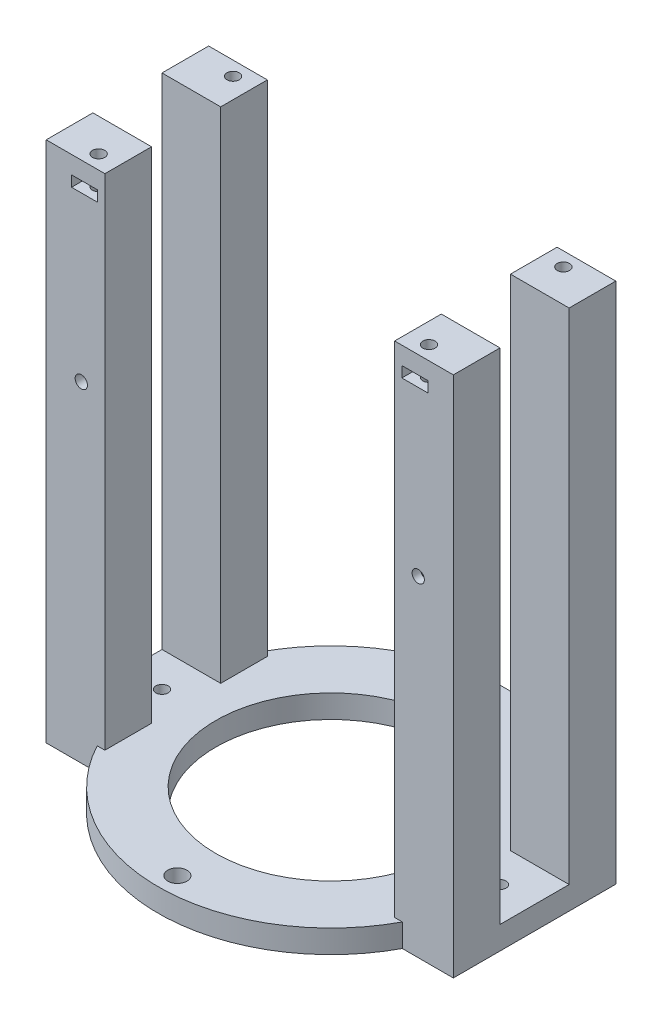
from build123d import *

# Parameters (mm, degrees)
BODY_DEPTH                    = 6
SKETCH2_W                     = 10.280011329
SKETCH2_H                     = 42.3
SKETCH2_W_2                   = 2
WINGS_DEPTH                   = 130
SKETCH3_R                     = 1.6
MOUNTING_BORE_DEPTH           = 152.726728034
CUT_EXCESS_MATERIAL_DEPTH     = 175.702604445
CUT_BATTERY_MOUNT_REACH       = 153.727
SKETCH6_R                     = 1.6
SKETCH8_W                     = 6.8
SKETCH8_H                     = 2.8
CAPTURE_NUT_1_DEPTH           = 7.3
CIRPATTERN1_COUNT             = 2
SKETCH10_W                    = 6.8
SKETCH10_H                    = 2.8
CAPTURE_NUT_2_DEPTH           = 7.3
CIRPATTERN2_COUNT             = 2
CUT_CENTER_HOLE_REACH         = 153.727
SKETCH11_R                    = 30
CUT_HARNESS_MOUNT_REACH       = 153.727
SKETCH12_R                    = 2.5
CAPTIVE_NUT_WALL_1_DEPTH      = 2.8
CAPTIVE_NUT_WALL_2_REACH      = 147.131
CAPTIVE_NUT_WALL_3_REACH      = 147.131
CAPTIVE_NUT_WALL_4_REACH      = 147.131
MIDDLE_DECK_HOLES_REACH       = 161.285
SKETCH20_R                    = 1.6
MIDDLE_DECK_CAPTIVE_NUT_DEPTH = 2.5
WING_EXTRA_WIDTH_1_DEPTH      = 3
WING_EXTRA_WIDTH_2_DEPTH      = 3


with BuildPart() as part:
    # Sketch1 → body (new body)
    with BuildSketch(Plane(origin=(0, 0, 0), x_dir=(1, 0, 0), z_dir=(0, 1, 0))):
        with BuildLine():
            ThreePointArc((-39.719988671, -21.15), (-45, 0), (-39.719988671, 21.15))
            Line((-39.719988671, 21.15), (-50, 21.15))
            Line((-50, 21.15), (-50, -21.15))
            Line((-50, -21.15), (-39.719988671, -21.15))
        make_face()
        with BuildLine():
            Line((-16, -21.15), (-16, 21.15))
            Line((-16, 21.15), (-39.719988671, 21.15))
            ThreePointArc((-39.719988671, 21.15), (-45, 0), (-39.719988671, -21.15))
            Line((-39.719988671, -21.15), (-16, -21.15))
        make_face()
        with BuildLine():
            Line((-39.719988671, 21.15), (-16, 21.15))
            Line((-16, 21.15), (-16, -21.15))
            Line((-16, -21.15), (-39.719988671, -21.15))
            ThreePointArc((-39.719988671, -21.15), (0, -45), (39.719988671, -21.15))
            Line((39.719988671, -21.15), (16, -21.15))
            Line((16, -21.15), (16, 21.15))
            Line((16, 21.15), (39.719988671, 21.15))
            ThreePointArc((39.719988671, 21.15), (0, 45), (-39.719988671, 21.15))
        make_face()
        with BuildLine():
            ThreePointArc((45, 0), (43.66004747, 10.899552968), (39.719988671, 21.15))
            Line((39.719988671, 21.15), (16, 21.15))
            Line((16, 21.15), (16, -21.15))
            Line((16, -21.15), (39.719988671, -21.15))
            ThreePointArc((39.719988671, -21.15), (43.66004747, -10.899552968), (45, 0))
        make_face()
        with BuildLine():
            Line((50, 21.15), (39.719988671, 21.15))
            ThreePointArc((39.719988671, 21.15), (43.66004747, 10.899552968), (45, 0))
            ThreePointArc((45, 0), (43.66004747, -10.899552968), (39.719988671, -21.15))
            Line((39.719988671, -21.15), (50, -21.15))
            Line((50, -21.15), (50, 21.15))
        make_face()
    extrude(amount=BODY_DEPTH)

    # Sketch2 → wings (add)
    with BuildSketch(Plane(origin=(0, 6, 0), x_dir=(1, 0, 0), z_dir=(0, 1, 0))):
        with Locations((44.859994336, 0)):
            Rectangle(SKETCH2_W, SKETCH2_H)
        with Locations((-44.859994336, 0)):
            Rectangle(SKETCH2_W, SKETCH2_H)
        with Locations((-38.719988671, 0)):
            Rectangle(SKETCH2_W_2, SKETCH2_H)
        with Locations((38.719988671, 0)):
            Rectangle(SKETCH2_W_2, SKETCH2_H)
    extrude(amount=WINGS_DEPTH)

    # Sketch3 → mounting-bore (cut, through all)
    with BuildSketch(Plane(origin=(0, 136, 0), x_dir=(1, 0, 0), z_dir=(0, 1, 0))):
        with Locations(Location((43, -17.5, 0), (0, 0, 270))):
            Circle(SKETCH3_R)
        with Locations(Location((-43, -17.5, 0), (0, 0, 270))):
            Circle(SKETCH3_R)
        with Locations(Location((-43, 17.5, 0), (0, 0, 270))):
            Circle(SKETCH3_R)
        with Locations(Location((43, 17.5, 0), (0, 0, 270))):
            Circle(SKETCH3_R)
    extrude(amount=-MOUNTING_BORE_DEPTH, mode=Mode.SUBTRACT)

    # Sketch5 → cut-excess-material (cut, through all)
    with BuildSketch(Plane(origin=(50, 0, 0), x_dir=(0, 0, -1), z_dir=(1, 0, 0))):
        Polygon((0, 6), (9, 6), (9, 136), (-9, 136), (-9, 6), align=None)
    extrude(amount=-CUT_EXCESS_MATERIAL_DEPTH, mode=Mode.SUBTRACT)

    # Sketch6 → cut-battery-mount (cut, up to next)
    with BuildSketch(Plane.XZ, mode=Mode.PRIVATE) as cut_battery_mount_sk1:
        with Locations(Location((-44, 0, 0), (0, 0, 270))):
            Circle(SKETCH6_R)
    cut_battery_mount_tool1 = extrude(cut_battery_mount_sk1.sketch, amount=-CUT_BATTERY_MOUNT_REACH, mode=Mode.PRIVATE) & part.part
    # Sketch6 → cut-battery-mount (cut, up to next)
    with BuildSketch(Plane.XZ, mode=Mode.PRIVATE) as cut_battery_mount_sk2:
        with Locations(Location((44, 0, 0), (0, 0, 270))):
            Circle(SKETCH6_R)
    cut_battery_mount_tool2 = extrude(cut_battery_mount_sk2.sketch, amount=-CUT_BATTERY_MOUNT_REACH, mode=Mode.PRIVATE) & part.part
    add(cut_battery_mount_tool1.solids().sort_by_distance((-44, 0, 0))[0], mode=Mode.SUBTRACT)
    add(cut_battery_mount_tool2.solids().sort_by_distance((44, 0, 0))[0], mode=Mode.SUBTRACT)

    # Sketch8 → capture-nut-1 (cut)
    with BuildSketch(Plane.XY.offset(21.15)):
        with Locations((42.999988671, 130)):
            Rectangle(SKETCH8_W, SKETCH8_H)
    capture_nut_1 = extrude(amount=-CAPTURE_NUT_1_DEPTH, mode=Mode.SUBTRACT)

    # CirPattern1: capture-nut-1 ×2 about axis
    cirpattern1_axis = Axis((0, 0, 0), (0, 1, 0))
    for i in range(1, CIRPATTERN1_COUNT):
        add(capture_nut_1.rotate(cirpattern1_axis, i * 360 / CIRPATTERN1_COUNT), mode=Mode.SUBTRACT)

    # Sketch10 → capture-nut-2 (cut)
    with BuildSketch(Plane(origin=(0, 0, -21.15), x_dir=(-1, 0, 0), z_dir=(0, 0, -1))):
        with Locations((-42.999988671, 130)):
            Rectangle(SKETCH10_W, SKETCH10_H)
    capture_nut_2 = extrude(amount=-CAPTURE_NUT_2_DEPTH, mode=Mode.SUBTRACT)

    # CirPattern2: capture-nut-2 ×2 about axis
    cirpattern2_axis = Axis((0, 0, 0), (0, 1, 0))
    for i in range(1, CIRPATTERN2_COUNT):
        add(capture_nut_2.rotate(cirpattern2_axis, i * 360 / CIRPATTERN2_COUNT), mode=Mode.SUBTRACT)

    # Sketch11 → cut-center-hole (cut, up to next)
    with BuildSketch(Plane.XZ, mode=Mode.PRIVATE) as cut_center_hole_sk1:
        with Locations(Location((0, 0, 0), (0, 0, 270))):
            Circle(SKETCH11_R)
    cut_center_hole_tool1 = extrude(cut_center_hole_sk1.sketch, amount=-CUT_CENTER_HOLE_REACH, mode=Mode.PRIVATE) & part.part
    add(cut_center_hole_tool1.solids().sort_by_distance((0, 0, 0))[0], mode=Mode.SUBTRACT)

    # Sketch12 → cut-harness-mount (cut, up to next)
    with BuildSketch(Plane.XZ, mode=Mode.PRIVATE) as cut_harness_mount_sk1:
        with Locations(Location((0, -40, 0), (0, 0, 270))):
            Circle(SKETCH12_R)
    cut_harness_mount_tool1 = extrude(cut_harness_mount_sk1.sketch, amount=-CUT_HARNESS_MOUNT_REACH, mode=Mode.PRIVATE) & part.part
    # Sketch12 → cut-harness-mount (cut, up to next)
    with BuildSketch(Plane.XZ, mode=Mode.PRIVATE) as cut_harness_mount_sk2:
        with Locations(Location((0, 40, 0), (0, 0, 270))):
            Circle(SKETCH12_R)
    cut_harness_mount_tool2 = extrude(cut_harness_mount_sk2.sketch, amount=-CUT_HARNESS_MOUNT_REACH, mode=Mode.PRIVATE) & part.part
    add(cut_harness_mount_tool1.solids().sort_by_distance((0, 0, -40))[0], mode=Mode.SUBTRACT)
    add(cut_harness_mount_tool2.solids().sort_by_distance((0, 0, 40))[0], mode=Mode.SUBTRACT)

    # Sketch13 → captive-nut-wall-1 (add)
    with BuildSketch(Plane(origin=(0, 128.6, 0), x_dir=(1, 0, 0), z_dir=(0, 1, 0))):
        Polygon((46.399988671, 13.85), (46.399988671, 17.5), (44.699994335, 14.555523439), (41.300005665, 14.555523439), (39.600011329, 17.5), (39.599988671, 13.85), align=None)
    extrude(amount=CAPTIVE_NUT_WALL_1_DEPTH)

    # Sketch14 → captive-nut-wall-2 (add, up to next)
    with BuildSketch(Plane(origin=(0, 128.6, 0), x_dir=(1, 0, 0), z_dir=(0, 1, 0)), mode=Mode.PRIVATE) as captive_nut_wall_2_sk1:
        Polygon((-39.599988671, 13.85), (-39.599988671, 17.5), (-41.299994335, 14.555503816), (-44.700005665, 14.555503816), (-46.400011329, 17.5), (-46.400011329, 13.85), align=None)
    captive_nut_wall_2_tool1 = extrude(captive_nut_wall_2_sk1.sketch, amount=CAPTIVE_NUT_WALL_2_REACH, mode=Mode.PRIVATE) - part.part
    add(captive_nut_wall_2_tool1.solids().sort_by_distance((-39.677166, 128.6, -15.675))[0])

    # Sketch16 → captive-nut-wall-3 (add, up to next)
    with BuildSketch(Plane(origin=(0, 128.6, 0), x_dir=(1, 0, 0), z_dir=(0, 1, 0)), mode=Mode.PRIVATE) as captive_nut_wall_3_sk1:
        Polygon((-46.399988671, -13.85), (-46.399988671, -17.5), (-44.699994335, -14.555523439), (-41.300005665, -14.555523439), (-39.600011329, -17.5), (-39.600011329, -13.85), align=None)
    captive_nut_wall_3_tool1 = extrude(captive_nut_wall_3_sk1.sketch, amount=CAPTIVE_NUT_WALL_3_REACH, mode=Mode.PRIVATE) - part.part
    add(captive_nut_wall_3_tool1.solids().sort_by_distance((-46.322812, 128.6, 15.675))[0])

    # Sketch17 → captive-nut-wall-4 (add, up to next)
    with BuildSketch(Plane(origin=(0, 128.6, 0), x_dir=(1, 0, 0), z_dir=(0, 1, 0)), mode=Mode.PRIVATE) as captive_nut_wall_4_sk1:
        Polygon((39.599988671, -13.85), (39.599988671, -17.5), (41.299994335, -14.555503816), (44.700005665, -14.555503816), (46.400011329, -17.5), (46.400011329, -13.85), align=None)
    captive_nut_wall_4_tool1 = extrude(captive_nut_wall_4_sk1.sketch, amount=CAPTIVE_NUT_WALL_4_REACH, mode=Mode.PRIVATE) - part.part
    add(captive_nut_wall_4_tool1.solids().sort_by_distance((39.677166, 128.6, 15.675))[0])

    # Sketch20 → middle-deck-holes (cut, up to next)
    with BuildSketch(Plane.XY.offset(21.15), mode=Mode.PRIVATE) as middle_deck_holes_sk1:
        with Locations((-43.859994335, 86)):
            Circle(SKETCH20_R)
    middle_deck_holes_tool1 = extrude(middle_deck_holes_sk1.sketch, amount=-MIDDLE_DECK_HOLES_REACH, mode=Mode.PRIVATE) & part.part
    # Sketch20 → middle-deck-holes (cut, up to next)
    with BuildSketch(Plane.XY.offset(21.15), mode=Mode.PRIVATE) as middle_deck_holes_sk2:
        with Locations((43.859994335, 86)):
            Circle(SKETCH20_R)
    middle_deck_holes_tool2 = extrude(middle_deck_holes_sk2.sketch, amount=-MIDDLE_DECK_HOLES_REACH, mode=Mode.PRIVATE) & part.part
    add(middle_deck_holes_tool1.solids().sort_by_distance((-43.859994, 86, 21.15))[0], mode=Mode.SUBTRACT)
    add(middle_deck_holes_tool2.solids().sort_by_distance((43.859994, 86, 21.15))[0], mode=Mode.SUBTRACT)

    # Sketch21 → middle-deck-captive-nut (cut)
    with BuildSketch(Plane(origin=(0, 0, 9), x_dir=(-1, 0, 0), z_dir=(0, 0, -1))):
        Polygon((44.609427523, 89.111004644), (41.540501876, 88.204530501), (40.791068688, 85.093525857), (43.110561148, 82.888995356), (46.179486795, 83.795469499), (46.928919982, 86.906474143), align=None)
        Polygon((-43.110561148, 89.111004644), (-46.179486795, 88.204530501), (-46.928919982, 85.093525857), (-44.609427523, 82.888995356), (-41.540501876, 83.795469499), (-40.791068688, 86.906474143), align=None)
    extrude(amount=-MIDDLE_DECK_CAPTIVE_NUT_DEPTH, mode=Mode.SUBTRACT)

    # Sketch22 → wing-extra-width-1 (add)
    with BuildSketch(Plane(origin=(50, 0, 0), x_dir=(0, 0, -1), z_dir=(1, 0, 0))):
        Polygon((21.15, 136), (9, 136), (9, 6), (-9, 6), (-9, 136), (-21.15, 136), (-21.15, 0), (21.15, 0), align=None)
    extrude(amount=WING_EXTRA_WIDTH_1_DEPTH)

    # Sketch24 → wing-extra-width-2 (add)
    with BuildSketch(Plane.ZY.offset(50)):
        Polygon((9, 136), (9, 6), (-9, 6), (-9, 136), (-21.15, 136), (-21.15, 0), (21.15, 0), (21.15, 136), align=None)
    extrude(amount=WING_EXTRA_WIDTH_2_DEPTH)


solid = part.part
